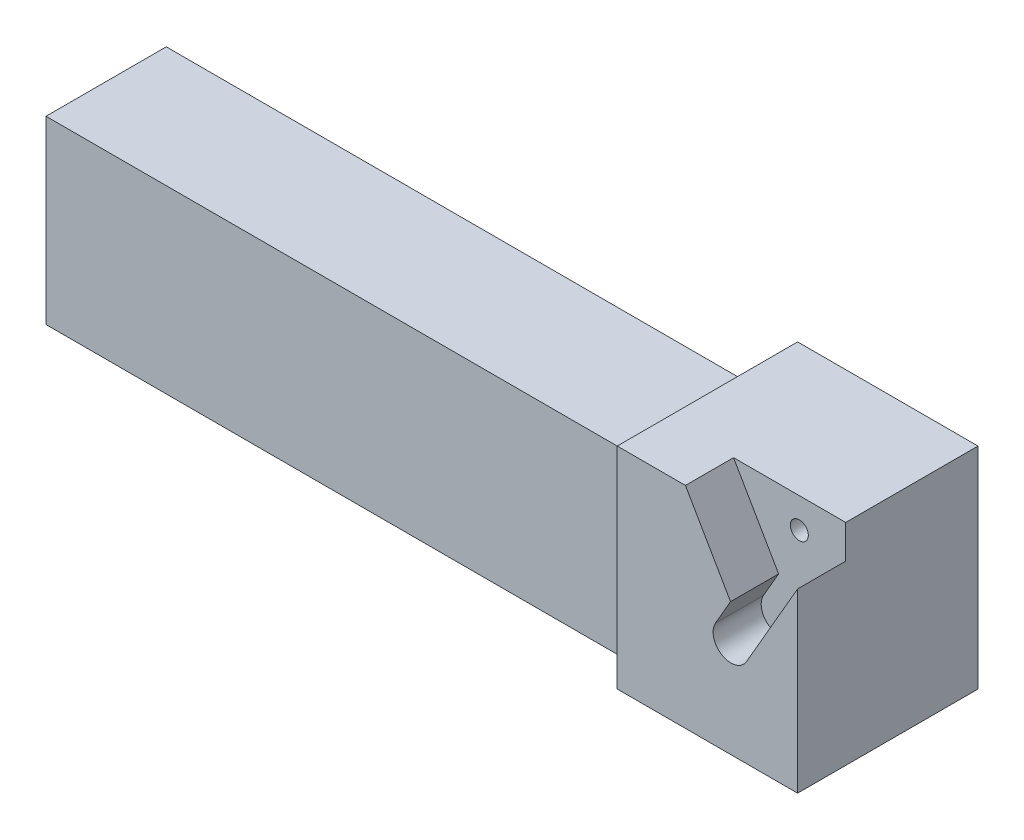
from build123d import *

# Parameters (mm, degrees)
SKETCH_1_W          = 100
SKETCH_1_H          = 30
EXTRUDE_1_DEPTH     = 20
SKETCH_2_W          = 30
SKETCH_2_H          = 35
EXTRUDE_2_DEPTH     = 30
FILLET_1_R          = 5
CUT_EXTRUDE_1_DEPTH = 8
SKETCH_4_R          = 1.5
CUT_EXTRUDE_2_DEPTH = 91.049986119


with BuildPart() as part:
    # 草图1 → 凸台-拉伸1 (new body)
    with BuildSketch(Plane.XY):
        with Locations((5, 0)):
            Rectangle(SKETCH_1_W, SKETCH_1_H)
    extrude(amount=EXTRUDE_1_DEPTH)

    # 草图2 → 凸台-拉伸2 (add)
    with BuildSketch(Plane(origin=(55, 0, 0), x_dir=(0, 0, -1), z_dir=(1, 0, 0))):
        with Locations((-10, 2.5)):
            Rectangle(SKETCH_2_W, SKETCH_2_H)
    extrude(amount=EXTRUDE_2_DEPTH)

    # 圆角1
    fillet_1_edges = [part.edges().sort_by_distance(p)[0] for p in [
        (55, 0, 0),
        (55, 15, 10),
        (55, 0, 20),
    ]]
    fillet(fillet_1_edges, radius=FILLET_1_R - 0.0001)  # a hair under: the kernel refuses the full size

    # 草图3 → 切除-拉伸1 (cut)
    with BuildSketch(Plane.XY.offset(25)):
        with BuildLine():
            Line((73.842770799, 7.009618943), (66.342770799, 20))
            Line((66.342770799, 20), (85, 20))
            Line((85, 20), (85, 14.424396121))
            Line((85, 14.424396121), (78.356092757, 2.916811216))
            Line((78.356092757, 2.916811216), (76.5, -0.298035743))
            ThreePointArc((76.5, -0.298035743), (72.432621566, -1.38788651), (71.342770799, 2.679491924))
            Line((71.342770799, 2.679491924), (73.842770799, 7.009618943))
        make_face()
    extrude(amount=-CUT_EXTRUDE_1_DEPTH, mode=Mode.SUBTRACT)

    # 草图4 → 切除-拉伸2 (cut, through all)
    with BuildSketch(Plane.XY.offset(17)):
        with Locations((77.2809236, 15.014563609)):
            Circle(SKETCH_4_R)
    extrude(amount=-CUT_EXTRUDE_2_DEPTH, mode=Mode.SUBTRACT)


solid = part.part
